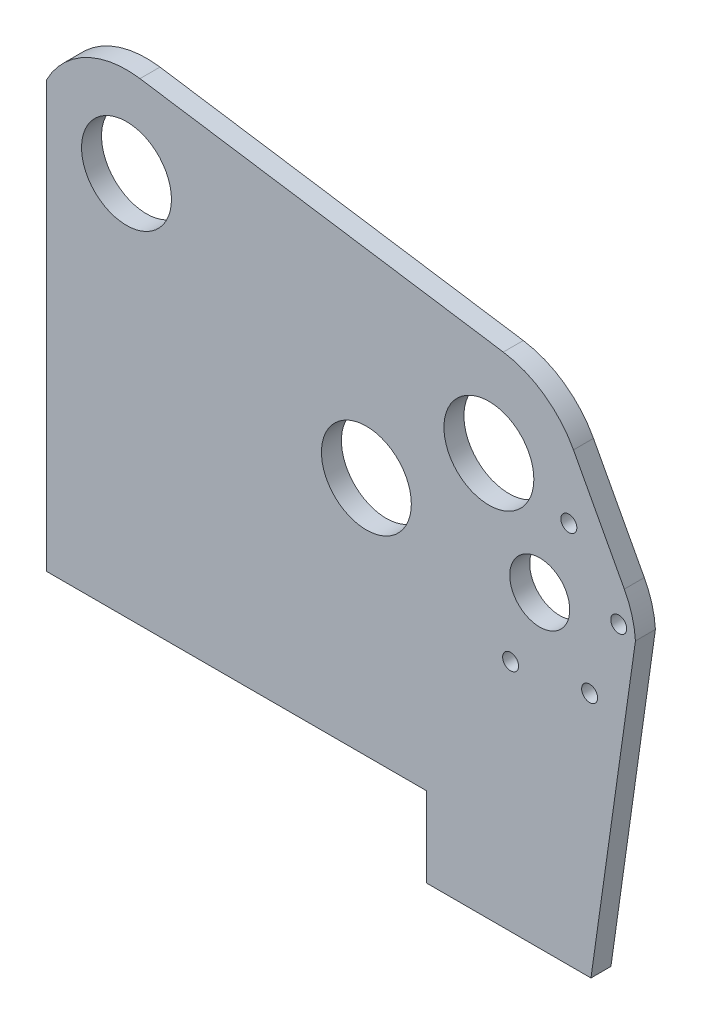
from build123d import *

# Parameters (mm, degrees)
SKETCH35_S_25_GCI_S_0001_2_R   = 14.2875
SKETCH35_S_25_GCI_S_0001_2_R_2 = 9.525
SKETCH35_S_25_GCI_S_0001_2_R_3 = 2.54
BOSS_EXTRUDE1_DEPTH            = 3.175


with BuildPart() as part:
    # Sketch35-S-25-GCI-S-0001<2> → Boss-Extrude1 (new, symmetric)
    with BuildSketch(Plane.XY):
        with BuildLine():
            Line((284.854151408, 256.846595739), (169.389291755, 274.377240703))
            ThreePointArc((169.389291755, 274.377240703), (152.104816905, 271.57508331), (139.7, 259.216860361))
            Line((139.7, 259.216860361), (139.7, 123.890913))
            Line((139.7, 123.890913), (260.4675512, 123.890913))
            Line((260.4675512, 123.890913), (260.4675512, 98.4885))
            Line((260.4675512, 98.4885), (312.720196403, 98.4885))
            Line((312.720196403, 98.4885), (326.857485939, 198.349596813))
            ThreePointArc((326.857485939, 198.349596813), (325.760302598, 204.779377488), (323.320168706, 210.828479687))
            Line((323.320168706, 210.828479687), (307.163388437, 241.073521451))
            ThreePointArc((307.163388437, 241.073521451), (297.875101338, 251.599774174), (284.854151408, 256.846595739))
        make_face()
        with Locations((241.342321581, 200.406)):
            Circle(SKETCH35_S_25_GCI_S_0001_2_R, mode=Mode.SUBTRACT)
        with Locations((280.278906868, 226.71193899)):
            Circle(SKETCH35_S_25_GCI_S_0001_2_R, mode=Mode.SUBTRACT)
        with Locations((296.435687138, 196.466897225)):
            Circle(SKETCH35_S_25_GCI_S_0001_2_R_2, mode=Mode.SUBTRACT)
        with Locations((321.547351387, 200.283219884)):
            Circle(SKETCH35_S_25_GCI_S_0001_2_R_3, mode=Mode.SUBTRACT)
        with Locations((287.184887385, 172.811396725)):
            Circle(SKETCH35_S_25_GCI_S_0001_2_R_3, mode=Mode.SUBTRACT)
        with Locations((312.296551634, 176.627719384)):
            Circle(SKETCH35_S_25_GCI_S_0001_2_R_3, mode=Mode.SUBTRACT)
        with Locations((165.1, 246.126)):
            Circle(SKETCH35_S_25_GCI_S_0001_2_R, mode=Mode.SUBTRACT)
        with Locations((305.686486891, 220.122397726)):
            Circle(SKETCH35_S_25_GCI_S_0001_2_R_3, mode=Mode.SUBTRACT)
    extrude(amount=BOSS_EXTRUDE1_DEPTH, both=True)


solid = part.part
